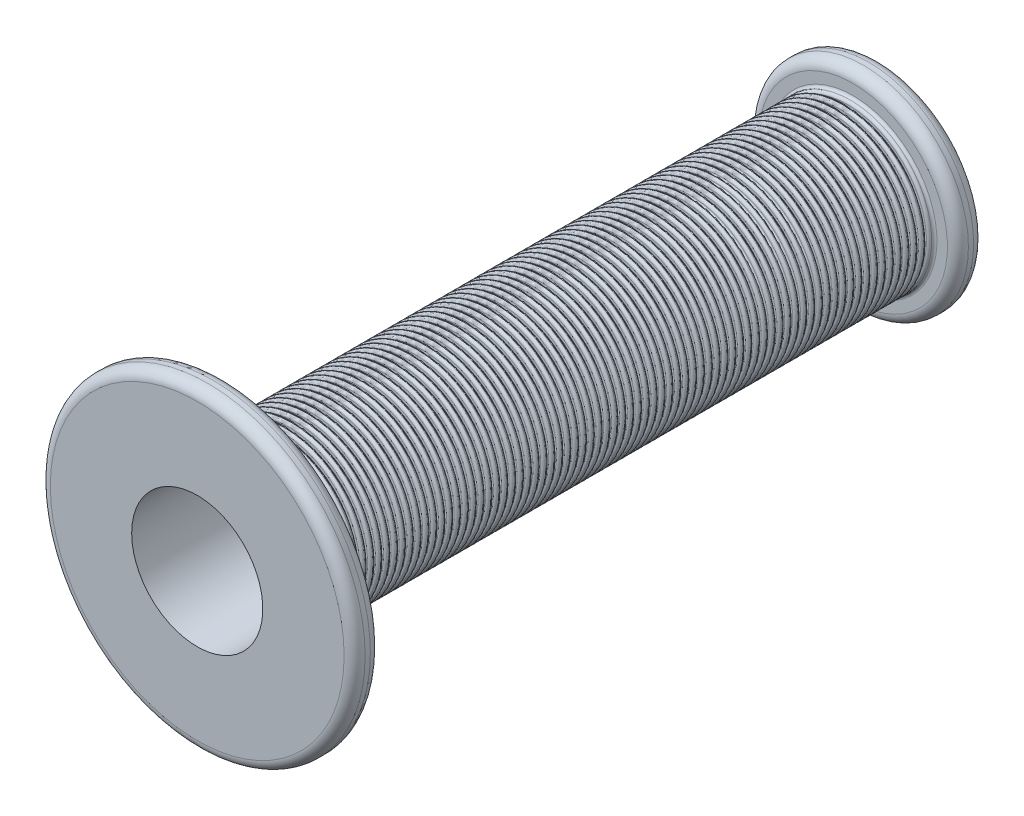
from build123d import *

# Parameters (mm, degrees)
SKETCH1_R               = 15.5
BOSS_EXTRUDE1_DEPTH     = 130
SKETCH3_R               = 30
BOSS_EXTRUDE2_DEPTH     = 5
SKETCH4_R               = 20
BOSS_EXTRUDE3_DEPTH     = 5
FILLET1_R               = 2
FILLET2_R               = 5
SKETCH5_W               = 0.5
SKETCH5_H               = 5.747352725
FILLET4_R               = 0.5
FILLET5_R               = 0.5
FILLET6_R               = 0.5
CUT_EXTRUDE1_DEPTH      = 137.747943312
CUT_EXTRUDE1_DEPTH_BACK = 137.747943312
SKETCH6_R               = 12.5


with BuildPart() as part:
    # Sketch1 → Boss-Extrude1 (new body)
    with BuildSketch(Plane.XY):
        Circle(SKETCH1_R)
    extrude(amount=BOSS_EXTRUDE1_DEPTH)

    # Sketch3 → Boss-Extrude2 (add)
    with BuildSketch(Plane.XY.offset(130)):
        Circle(SKETCH3_R)
    extrude(amount=-BOSS_EXTRUDE2_DEPTH)

    # Sketch4 → Boss-Extrude3 (add)
    with BuildSketch(Plane(origin=(0, 0, 0), x_dir=(-1, 0, 0), z_dir=(0, 0, -1))):
        Circle(SKETCH4_R)
    extrude(amount=-BOSS_EXTRUDE3_DEPTH)

    # Fillet1
    fillet1_edges = [part.edges().sort_by_distance(p)[0] for p in [
        (20, 0, 5),
        (20, 0, 0),
        (-30, 0, 125),
        (-30, 0, 130),
    ]]
    fillet(fillet1_edges, radius=FILLET1_R)

    # Fillet2
    fillet2_edges = [part.edges().sort_by_distance(p)[0] for p in [
        (-15.5, 0, 125),
    ]]
    fillet(fillet2_edges, radius=FILLET2_R)

    # Sketch5 → Cut-Revolve1 (revolve, cut)
    with BuildSketch(Plane(origin=(0, 0, 0), x_dir=(0, 0, -1), z_dir=(1, 0, 0)), mode=Mode.PRIVATE) as cut_revolve1_sk:
        with Locations((-6.25, 17.373676363)):
            Rectangle(SKETCH5_W, SKETCH5_H)
        with Locations((-7.75, 17.373676363)):
            Rectangle(SKETCH5_W, SKETCH5_H)
        with Locations((-9.25, 17.373676363)):
            Rectangle(SKETCH5_W, SKETCH5_H)
        with Locations((-10.75, 17.373676363)):
            Rectangle(SKETCH5_W, SKETCH5_H)
        with Locations((-12.25, 17.373676363)):
            Rectangle(SKETCH5_W, SKETCH5_H)
        with Locations((-13.75, 17.373676363)):
            Rectangle(SKETCH5_W, SKETCH5_H)
        with Locations((-15.25, 17.373676363)):
            Rectangle(SKETCH5_W, SKETCH5_H)
        with Locations((-16.75, 17.373676363)):
            Rectangle(SKETCH5_W, SKETCH5_H)
        with Locations((-18.25, 17.373676363)):
            Rectangle(SKETCH5_W, SKETCH5_H)
        with Locations((-19.75, 17.373676363)):
            Rectangle(SKETCH5_W, SKETCH5_H)
        with Locations((-21.25, 17.373676363)):
            Rectangle(SKETCH5_W, SKETCH5_H)
        with Locations((-22.75, 17.373676363)):
            Rectangle(SKETCH5_W, SKETCH5_H)
        with Locations((-24.25, 17.373676363)):
            Rectangle(SKETCH5_W, SKETCH5_H)
        with Locations((-25.75, 17.373676363)):
            Rectangle(SKETCH5_W, SKETCH5_H)
        with Locations((-27.25, 17.373676363)):
            Rectangle(SKETCH5_W, SKETCH5_H)
        with Locations((-28.75, 17.373676363)):
            Rectangle(SKETCH5_W, SKETCH5_H)
        with Locations((-30.25, 17.373676363)):
            Rectangle(SKETCH5_W, SKETCH5_H)
        with Locations((-31.75, 17.373676363)):
            Rectangle(SKETCH5_W, SKETCH5_H)
        with Locations((-33.25, 17.373676363)):
            Rectangle(SKETCH5_W, SKETCH5_H)
        with Locations((-34.75, 17.373676363)):
            Rectangle(SKETCH5_W, SKETCH5_H)
        with Locations((-36.25, 17.373676363)):
            Rectangle(SKETCH5_W, SKETCH5_H)
        with Locations((-37.75, 17.373676363)):
            Rectangle(SKETCH5_W, SKETCH5_H)
        with Locations((-39.25, 17.373676363)):
            Rectangle(SKETCH5_W, SKETCH5_H)
        with Locations((-40.75, 17.373676363)):
            Rectangle(SKETCH5_W, SKETCH5_H)
        with Locations((-42.25, 17.373676363)):
            Rectangle(SKETCH5_W, SKETCH5_H)
        with Locations((-43.75, 17.373676363)):
            Rectangle(SKETCH5_W, SKETCH5_H)
        with Locations((-45.25, 17.373676363)):
            Rectangle(SKETCH5_W, SKETCH5_H)
        with Locations((-46.75, 17.373676363)):
            Rectangle(SKETCH5_W, SKETCH5_H)
        with Locations((-48.25, 17.373676363)):
            Rectangle(SKETCH5_W, SKETCH5_H)
        with Locations((-49.75, 17.373676363)):
            Rectangle(SKETCH5_W, SKETCH5_H)
        with Locations((-51.25, 17.373676363)):
            Rectangle(SKETCH5_W, SKETCH5_H)
        with Locations((-52.75, 17.373676363)):
            Rectangle(SKETCH5_W, SKETCH5_H)
        with Locations((-54.25, 17.373676363)):
            Rectangle(SKETCH5_W, SKETCH5_H)
        with Locations((-55.75, 17.373676363)):
            Rectangle(SKETCH5_W, SKETCH5_H)
        with Locations((-57.25, 17.373676363)):
            Rectangle(SKETCH5_W, SKETCH5_H)
        with Locations((-58.75, 17.373676363)):
            Rectangle(SKETCH5_W, SKETCH5_H)
        with Locations((-60.25, 17.373676363)):
            Rectangle(SKETCH5_W, SKETCH5_H)
        with Locations((-61.75, 17.373676363)):
            Rectangle(SKETCH5_W, SKETCH5_H)
        with Locations((-63.25, 17.373676363)):
            Rectangle(SKETCH5_W, SKETCH5_H)
        with Locations((-64.75, 17.373676363)):
            Rectangle(SKETCH5_W, SKETCH5_H)
        with Locations((-66.25, 17.373676363)):
            Rectangle(SKETCH5_W, SKETCH5_H)
        with Locations((-67.75, 17.373676363)):
            Rectangle(SKETCH5_W, SKETCH5_H)
        with Locations((-69.25, 17.373676363)):
            Rectangle(SKETCH5_W, SKETCH5_H)
        with Locations((-70.75, 17.373676363)):
            Rectangle(SKETCH5_W, SKETCH5_H)
        with Locations((-72.25, 17.373676363)):
            Rectangle(SKETCH5_W, SKETCH5_H)
        with Locations((-73.75, 17.373676363)):
            Rectangle(SKETCH5_W, SKETCH5_H)
        with Locations((-75.25, 17.373676363)):
            Rectangle(SKETCH5_W, SKETCH5_H)
        with Locations((-76.75, 17.373676363)):
            Rectangle(SKETCH5_W, SKETCH5_H)
        with Locations((-78.25, 17.373676363)):
            Rectangle(SKETCH5_W, SKETCH5_H)
        with Locations((-79.75, 17.373676363)):
            Rectangle(SKETCH5_W, SKETCH5_H)
        with Locations((-81.25, 17.373676363)):
            Rectangle(SKETCH5_W, SKETCH5_H)
        with Locations((-82.75, 17.373676363)):
            Rectangle(SKETCH5_W, SKETCH5_H)
        with Locations((-84.25, 17.373676363)):
            Rectangle(SKETCH5_W, SKETCH5_H)
        with Locations((-85.75, 17.373676363)):
            Rectangle(SKETCH5_W, SKETCH5_H)
        with Locations((-87.25, 17.373676363)):
            Rectangle(SKETCH5_W, SKETCH5_H)
        with Locations((-88.75, 17.373676363)):
            Rectangle(SKETCH5_W, SKETCH5_H)
        with Locations((-90.25, 17.373676363)):
            Rectangle(SKETCH5_W, SKETCH5_H)
        with Locations((-91.75, 17.373676363)):
            Rectangle(SKETCH5_W, SKETCH5_H)
        with Locations((-93.25, 17.373676363)):
            Rectangle(SKETCH5_W, SKETCH5_H)
        with Locations((-94.75, 17.373676363)):
            Rectangle(SKETCH5_W, SKETCH5_H)
        with Locations((-96.25, 17.373676363)):
            Rectangle(SKETCH5_W, SKETCH5_H)
        with Locations((-97.75, 17.373676363)):
            Rectangle(SKETCH5_W, SKETCH5_H)
        with Locations((-99.25, 17.373676363)):
            Rectangle(SKETCH5_W, SKETCH5_H)
        with Locations((-100.75, 17.373676363)):
            Rectangle(SKETCH5_W, SKETCH5_H)
        with Locations((-102.25, 17.373676363)):
            Rectangle(SKETCH5_W, SKETCH5_H)
        with Locations((-103.75, 17.373676363)):
            Rectangle(SKETCH5_W, SKETCH5_H)
        with Locations((-105.25, 17.373676363)):
            Rectangle(SKETCH5_W, SKETCH5_H)
        with Locations((-106.75, 17.373676363)):
            Rectangle(SKETCH5_W, SKETCH5_H)
        with Locations((-108.25, 17.373676363)):
            Rectangle(SKETCH5_W, SKETCH5_H)
        with Locations((-109.75, 17.373676363)):
            Rectangle(SKETCH5_W, SKETCH5_H)
        with Locations((-111.25, 17.373676363)):
            Rectangle(SKETCH5_W, SKETCH5_H)
        with Locations((-112.75, 17.373676363)):
            Rectangle(SKETCH5_W, SKETCH5_H)
        with Locations((-114.25, 17.373676363)):
            Rectangle(SKETCH5_W, SKETCH5_H)
        with Locations((-115.75, 17.373676363)):
            Rectangle(SKETCH5_W, SKETCH5_H)
        with Locations((-117.25, 17.373676363)):
            Rectangle(SKETCH5_W, SKETCH5_H)
        with Locations((-118.75, 17.373676363)):
            Rectangle(SKETCH5_W, SKETCH5_H)
    revolve(cut_revolve1_sk.sketch.rotate(Axis((0, 0, 0), (0, 0, 1)), 90), axis=Axis((0, 0, 0), (0, 0, 1)), mode=Mode.SUBTRACT)

    # Fillet4
    fillet4_edges = [part.edges().sort_by_distance(p)[0] for p in [
        (-15.5, 0, 42.5),
        (-15.5, 0, 44),
        (-15.5, 0, 45.5),
        (-15.5, 0, 45),
        (-15.5, 0, 47),
        (-15.5, 0, 46.5),
        (-15.5, 0, 48.5),
        (-15.5, 0, 48),
        (-15.5, 0, 50),
        (-15.5, 0, 49.5),
        (-15.5, 0, 51.5),
        (-15.5, 0, 51),
        (-15.5, 0, 53),
        (-15.5, 0, 52.5),
        (-15.5, 0, 54.5),
        (-15.5, 0, 54),
        (-15.5, 0, 56),
        (-15.5, 0, 55.5),
        (-15.5, 0, 57.5),
        (-15.5, 0, 57),
        (-15.5, 0, 59),
        (-15.5, 0, 58.5),
        (-15.5, 0, 60.5),
        (-15.5, 0, 60),
        (-15.5, 0, 62),
        (-15.5, 0, 61.5),
        (-15.5, 0, 63.5),
        (-15.5, 0, 63),
        (-15.5, 0, 65),
        (-15.5, 0, 64.5),
        (-15.5, 0, 66.5),
        (-15.5, 0, 66),
        (-15.5, 0, 68),
        (-15.5, 0, 67.5),
        (-15.5, 0, 69.5),
        (-15.5, 0, 69),
        (-15.5, 0, 71),
        (-15.5, 0, 70.5),
        (-15.5, 0, 72),
    ]]
    fillet(fillet4_edges, radius=FILLET4_R - 0.0001)  # a hair under: the kernel refuses the full size

    # Fillet5
    fillet5_edges = [part.edges().sort_by_distance(p)[0] for p in [
        (-15.5, 0, 5),
        (-15.5, 0, 6),
        (-15.5, 0, 6.5),
        (-15.5, 0, 8),
        (-15.5, 0, 7.5),
        (-15.5, 0, 9.5),
        (-15.5, 0, 9),
        (-15.5, 0, 11),
        (-15.5, 0, 10.5),
        (-15.5, 0, 12.5),
        (-15.5, 0, 12),
        (-15.5, 0, 14),
        (-15.5, 0, 13.5),
        (-15.5, 0, 15.5),
        (-15.5, 0, 15),
        (-15.5, 0, 17),
        (-15.5, 0, 16.5),
        (-15.5, 0, 18.5),
        (-15.5, 0, 18),
        (-15.5, 0, 20),
        (-15.5, 0, 19.5),
        (-15.5, 0, 21.5),
        (-15.5, 0, 21),
        (-15.5, 0, 23),
        (-15.5, 0, 22.5),
        (-15.5, 0, 24.5),
        (-15.5, 0, 24),
        (-15.5, 0, 26),
        (-15.5, 0, 25.5),
        (-15.5, 0, 27.5),
        (-15.5, 0, 27),
        (14.5, 0, 27),
        (-15.5, 0, 29),
        (-15.5, 0, 28.5),
        (-15.5, 0, 30),
        (14.5, 0, 30),
        (-15.5, 0, 32),
        (-15.5, 0, 31.5),
        (14.5, 0, 31.5),
        (-15.5, 0, 33.5),
        (-15.5, 0, 33),
        (-15.5, 0, 35),
        (-15.5, 0, 34.5),
        (-15.5, 0, 36.5),
        (-15.5, 0, 36),
        (14.5, 0, 36),
        (-15.5, 0, 38),
        (-15.5, 0, 37.5),
        (-15.5, 0, 39.5),
        (-15.5, 0, 39),
        (-15.5, 0, 41),
        (-15.5, 0, 40.5),
        (-15.5, 0, 42),
        (-15.5, 0, 43.5),
    ]]
    fillet(fillet5_edges, radius=FILLET5_R - 0.0001)  # a hair under: the kernel refuses the full size

    # Fillet6
    fillet6_edges = [part.edges().sort_by_distance(p)[0] for p in [
        (-15.5, 0, 30.5),
        (-15.5, 0, 72.5),
        (-15.5, 0, 74),
        (-15.5, 0, 73.5),
        (-15.5, 0, 75.5),
        (-15.5, 0, 75),
        (-15.5, 0, 77),
        (-15.5, 0, 76.5),
        (-15.5, 0, 78.5),
        (-15.5, 0, 78),
        (-15.5, 0, 80),
        (-15.5, 0, 79.5),
        (-15.5, 0, 81.5),
        (-15.5, 0, 81),
        (-15.5, 0, 83),
        (-15.5, 0, 82.5),
        (-15.5, 0, 84.5),
        (-15.5, 0, 84),
        (-15.5, 0, 86),
        (-15.5, 0, 85.5),
        (-15.5, 0, 87.5),
        (-15.5, 0, 87),
        (-15.5, 0, 89),
        (-15.5, 0, 88.5),
        (-15.5, 0, 90.5),
        (-15.5, 0, 90),
        (-15.5, 0, 92),
        (-15.5, 0, 91.5),
        (-15.5, 0, 93.5),
        (-15.5, 0, 93),
        (-15.5, 0, 95),
        (-15.5, 0, 94.5),
        (-15.5, 0, 96.5),
        (-15.5, 0, 96),
        (-15.5, 0, 98),
        (-15.5, 0, 97.5),
        (-15.5, 0, 99.5),
        (-15.5, 0, 99),
        (-15.5, 0, 101),
        (-15.5, 0, 100.5),
        (-15.5, 0, 102.5),
        (-15.5, 0, 102),
        (-15.5, 0, 104),
        (-15.5, 0, 103.5),
        (-15.5, 0, 105.5),
        (-15.5, 0, 105),
        (-15.5, 0, 107),
        (-15.5, 0, 106.5),
        (-15.5, 0, 108.5),
        (-15.5, 0, 108),
        (-15.5, 0, 110),
        (-15.5, 0, 109.5),
        (-15.5, 0, 111.5),
        (-15.5, 0, 111),
        (-15.5, 0, 113),
        (-15.5, 0, 112.5),
        (-15.5, 0, 114.5),
        (-15.5, 0, 114),
        (-15.5, 0, 116),
        (-15.5, 0, 115.5),
        (-15.5, 0, 117.5),
        (-15.5, 0, 117),
        (-15.5, 0, 119),
    ]]
    fillet(fillet6_edges, radius=FILLET6_R - 0.0001)  # a hair under: the kernel refuses the full size

    # Sketch6 → Cut-Extrude1 (cut, two sides: drawn at the far end of the back side and taken through both)
    with BuildSketch(Plane(origin=(0, 0, 0), x_dir=(-1, 0, 0), z_dir=(0, 0, -1)).offset(-CUT_EXTRUDE1_DEPTH_BACK)):
        Circle(SKETCH6_R)
    extrude(amount=CUT_EXTRUDE1_DEPTH + CUT_EXTRUDE1_DEPTH_BACK, mode=Mode.SUBTRACT)


solid = part.part
